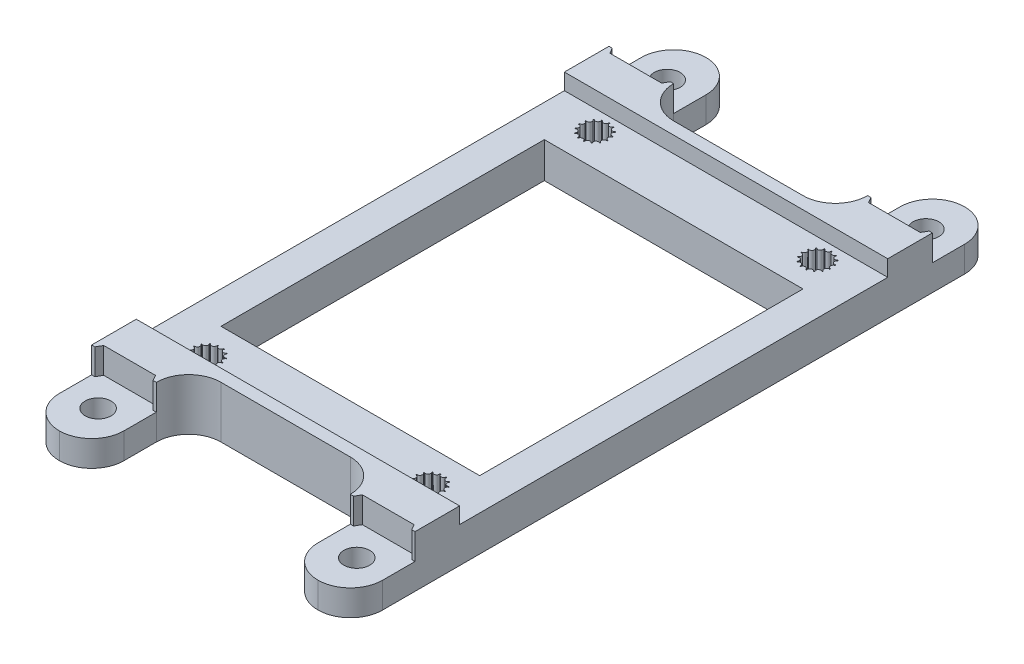
from build123d import *

# Parameters (mm, degrees)
SKETCH1_W                                  = 50
SKETCH1_H                                  = 70
BOSS_EXTRUDE1_DEPTH                        = 8
CUT_EXTRUDE1_DEPTH                         = 8
MIRROR1_AT_THE_SECOND_PLANE_COPY_1_DEPTH   = 8
SKETCH3_W                                  = 10
SKETCH3_H                                  = 15
SKETCH3_R                                  = 2
BOSS_EXTRUDE2_DEPTH                        = 8
MIRROR2_AT_THE_SECOND_PLANE_COPY_1_SKETC_W = 10
MIRROR2_AT_THE_SECOND_PLANE_COPY_1_SKETC_H = 15
MIRROR2_AT_THE_SECOND_PLANE_COPY_1_SKETC_R = 2
MIRROR2_AT_THE_SECOND_PLANE_COPY_1_DEPTH   = 8
FILLET1_R                                  = 5
CUT_EXTRUDE2_DEPTH                         = 4
MIRROR4_AT_THE_SECOND_PLANE_COPY_1_DEPTH   = 4
SKETCH5_W                                  = 40
SKETCH5_H                                  = 50
CUT_EXTRUDE3_DEPTH                         = 13
SKETCH6_W                                  = 50
SKETCH6_H                                  = 66.2
CUT_EXTRUDE4_DEPTH                         = 2.5


with BuildPart() as part:
    # Sketch1 → Boss-Extrude1 (new body)
    with BuildSketch(Plane(origin=(0, 0, 0), x_dir=(1, 0, 0), z_dir=(0, 1, 0))):
        with Locations((25, 35)):
            Rectangle(SKETCH1_W, SKETCH1_H)
    extrude(amount=BOSS_EXTRUDE1_DEPTH)

    # Sketch2 → Cut-Extrude1 (cut)
    with BuildSketch(Plane(origin=(0, 8, 0), x_dir=(1, 0, 0), z_dir=(0, 1, 0))):
        with BuildLine():
            ThreePointArc((9.960667609, 4.372293474), (9.639865506, 4.806622343), (10.043959363, 5.164761577))
            ThreePointArc((10.043959363, 5.164761577), (10.037674265, 5.235189042), (10.029179325, 5.305384245))
            ThreePointArc((10.029179325, 5.305384245), (9.559454555, 5.57168144), (9.782944313, 6.063217688))
            ThreePointArc((9.782944313, 6.063217688), (9.748557159, 6.125), (9.712245684, 6.185671305))
            ThreePointArc((9.712245684, 6.185671305), (9.174817927, 6.237891622), (9.179060176, 6.777833803))
            ThreePointArc((9.179060176, 6.777833803), (9.122516818, 6.820288237), (9.064667392, 6.860945025))
            ThreePointArc((9.064667392, 6.860945025), (8.55246279, 6.690059097), (8.336724007, 7.185046302))
            ThreePointArc((8.336724007, 7.185046302), (8.267801304, 7.200832102), (8.198416619, 7.214444444))
            ThreePointArc((8.198416619, 7.214444444), (7.8, 6.85), (7.401583381, 7.214444444))
            ThreePointArc((7.401583381, 7.214444444), (7.332198696, 7.200832102), (7.263275993, 7.185046302))
            ThreePointArc((7.263275993, 7.185046302), (7.279414078, 7.121153089), (7.284842553, 7.05547728))
            ThreePointArc((7.284842553, 7.05547728), (6.985331413, 6.668305497), (6.535332608, 6.860945025))
            ThreePointArc((6.535332608, 6.860945025), (6.477483182, 6.820288237), (6.420939824, 6.777833803))
            ThreePointArc((6.420939824, 6.777833803), (6.500218564, 6.651820533), (6.527924143, 6.505543864))
            ThreePointArc((6.527924143, 6.505543864), (6.30671462, 6.147725523), (5.887754316, 6.185671305))
            ThreePointArc((5.887754316, 6.185671305), (5.851442841, 6.125), (5.817055687, 6.063217688))
            ThreePointArc((5.817055687, 6.063217688), (5.993869104, 5.915772772), (6.060122838, 5.695288237))
            ThreePointArc((6.060122838, 5.695288237), (5.909400931, 5.382461716), (5.570820675, 5.305384245))
            ThreePointArc((5.570820675, 5.305384245), (5.562325735, 5.235189042), (5.556040637, 5.164761577))
            ThreePointArc((5.556040637, 5.164761577), (5.842937532, 5.049867127), (5.962325735, 4.764810958))
            ThreePointArc((5.962325735, 4.764810958), (5.871196794, 4.510648276), (5.639332391, 4.372293474))
            ThreePointArc((5.639332391, 4.372293474), (5.660122838, 4.304711763), (5.683026546, 4.237816691))
            ThreePointArc((5.683026546, 4.237816691), (6.066656087, 4.212169481), (6.251442841, 3.875))
            ThreePointArc((6.251442841, 3.875), (6.20640772, 3.690609287), (6.081443165, 3.547738864))
            ThreePointArc((6.081443165, 3.547738864), (6.127924143, 3.494456136), (6.176056398, 3.442660224))
            ThreePointArc((6.176056398, 3.442660224), (6.617892025, 3.554258631), (6.877483182, 3.179711763))
            ThreePointArc((6.877483182, 3.179711763), (6.863028211, 3.073151777), (6.820708029, 2.974293398))
            ThreePointArc((6.820708029, 2.974293398), (6.884842553, 2.94452272), (6.949880851, 2.916781953))
            ThreePointArc((6.949880851, 2.916781953), (7.391666595, 3.194722659), (7.732198696, 2.799167898))
            ThreePointArc((7.732198696, 2.799167898), (7.731473708, 2.775095823), (7.729301372, 2.751111007))
            ThreePointArc((7.729301372, 2.751111007), (7.8, 2.75), (7.870698628, 2.751111007))
            ThreePointArc((7.870698628, 2.751111007), (8.184636628, 3.190426939), (8.650119149, 2.916781953))
            ThreePointArc((8.650119149, 2.916781953), (8.715157447, 2.94452272), (8.779291971, 2.974293398))
            ThreePointArc((8.779291971, 2.974293398), (8.887402717, 3.50331856), (9.423943602, 3.442660224))
            ThreePointArc((9.423943602, 3.442660224), (9.472075857, 3.494456136), (9.518556835, 3.547738864))
            ThreePointArc((9.518556835, 3.547738864), (9.402146997, 4.075), (9.916973454, 4.237816691))
            ThreePointArc((9.916973454, 4.237816691), (9.939877162, 4.304711763), (9.960667609, 4.372293474))
        make_face()
    cut_extrude1 = extrude(amount=-CUT_EXTRUDE1_DEPTH, mode=Mode.SUBTRACT)

    # Mirror1: Cut-Extrude1 across plane
    add(cut_extrude1.mirror(Plane(origin=(0, 0, -35), x_dir=(1, 0, 0), z_dir=(0, 0, -1))), mode=Mode.SUBTRACT)

    # Mirror1 at the second plane: Cut-Extrude1 across plane
    add(cut_extrude1.mirror(Plane.ZY.offset(-25)), mode=Mode.SUBTRACT)

    # Mirror1 at the second plane copy 1 sketc → Mirror1 at the second plane copy 1 (cut)
    with BuildSketch(Plane(origin=(50, 8, -70), x_dir=(-1, 0, 0), z_dir=(0, 1, 0))):
        with BuildLine():
            ThreePointArc((9.960667609, 4.372293474), (9.639865506, 4.806622343), (10.043959363, 5.164761577))
            ThreePointArc((10.043959363, 5.164761577), (10.037674265, 5.235189042), (10.029179325, 5.305384245))
            ThreePointArc((10.029179325, 5.305384245), (9.559454555, 5.57168144), (9.782944313, 6.063217688))
            ThreePointArc((9.782944313, 6.063217688), (9.748557159, 6.125), (9.712245684, 6.185671305))
            ThreePointArc((9.712245684, 6.185671305), (9.174817927, 6.237891622), (9.179060176, 6.777833803))
            ThreePointArc((9.179060176, 6.777833803), (9.122516818, 6.820288237), (9.064667392, 6.860945025))
            ThreePointArc((9.064667392, 6.860945025), (8.55246279, 6.690059097), (8.336724007, 7.185046302))
            ThreePointArc((8.336724007, 7.185046302), (8.267801304, 7.200832102), (8.198416619, 7.214444444))
            ThreePointArc((8.198416619, 7.214444444), (7.8, 6.85), (7.401583381, 7.214444444))
            ThreePointArc((7.401583381, 7.214444444), (7.332198696, 7.200832102), (7.263275993, 7.185046302))
            ThreePointArc((7.263275993, 7.185046302), (7.279414078, 7.121153089), (7.284842553, 7.05547728))
            ThreePointArc((7.284842553, 7.05547728), (6.985331413, 6.668305497), (6.535332608, 6.860945025))
            ThreePointArc((6.535332608, 6.860945025), (6.477483182, 6.820288237), (6.420939824, 6.777833803))
            ThreePointArc((6.420939824, 6.777833803), (6.500218564, 6.651820533), (6.527924143, 6.505543864))
            ThreePointArc((6.527924143, 6.505543864), (6.30671462, 6.147725523), (5.887754316, 6.185671305))
            ThreePointArc((5.887754316, 6.185671305), (5.851442841, 6.125), (5.817055687, 6.063217688))
            ThreePointArc((5.817055687, 6.063217688), (5.993869104, 5.915772772), (6.060122838, 5.695288237))
            ThreePointArc((6.060122838, 5.695288237), (5.909400931, 5.382461716), (5.570820675, 5.305384245))
            ThreePointArc((5.570820675, 5.305384245), (5.562325735, 5.235189042), (5.556040637, 5.164761577))
            ThreePointArc((5.556040637, 5.164761577), (5.842937532, 5.049867127), (5.962325735, 4.764810958))
            ThreePointArc((5.962325735, 4.764810958), (5.871196794, 4.510648276), (5.639332391, 4.372293474))
            ThreePointArc((5.639332391, 4.372293474), (5.660122838, 4.304711763), (5.683026546, 4.237816691))
            ThreePointArc((5.683026546, 4.237816691), (6.066656087, 4.212169481), (6.251442841, 3.875))
            ThreePointArc((6.251442841, 3.875), (6.20640772, 3.690609287), (6.081443165, 3.547738864))
            ThreePointArc((6.081443165, 3.547738864), (6.127924143, 3.494456136), (6.176056398, 3.442660224))
            ThreePointArc((6.176056398, 3.442660224), (6.617892025, 3.554258631), (6.877483182, 3.179711763))
            ThreePointArc((6.877483182, 3.179711763), (6.863028211, 3.073151777), (6.820708029, 2.974293398))
            ThreePointArc((6.820708029, 2.974293398), (6.884842553, 2.94452272), (6.949880851, 2.916781953))
            ThreePointArc((6.949880851, 2.916781953), (7.391666595, 3.194722659), (7.732198696, 2.799167898))
            ThreePointArc((7.732198696, 2.799167898), (7.731473708, 2.775095823), (7.729301372, 2.751111007))
            ThreePointArc((7.729301372, 2.751111007), (7.8, 2.75), (7.870698628, 2.751111007))
            ThreePointArc((7.870698628, 2.751111007), (8.184636628, 3.190426939), (8.650119149, 2.916781953))
            ThreePointArc((8.650119149, 2.916781953), (8.715157447, 2.94452272), (8.779291971, 2.974293398))
            ThreePointArc((8.779291971, 2.974293398), (8.887402717, 3.50331856), (9.423943602, 3.442660224))
            ThreePointArc((9.423943602, 3.442660224), (9.472075857, 3.494456136), (9.518556835, 3.547738864))
            ThreePointArc((9.518556835, 3.547738864), (9.402146997, 4.075), (9.916973454, 4.237816691))
            ThreePointArc((9.916973454, 4.237816691), (9.939877162, 4.304711763), (9.960667609, 4.372293474))
        make_face()
    extrude(amount=-MIRROR1_AT_THE_SECOND_PLANE_COPY_1_DEPTH, mode=Mode.SUBTRACT)

    # Sketch3 → Boss-Extrude2 (add)
    with BuildSketch(Plane(origin=(0, 8, 0), x_dir=(1, 0, 0), z_dir=(0, 1, 0))):
        with Locations((5, -7.5)):
            Rectangle(SKETCH3_W, SKETCH3_H)
        with Locations(Location((5, -9, 0), (0, 0, 270))):
            Circle(SKETCH3_R, mode=Mode.SUBTRACT)
    boss_extrude2 = extrude(amount=-BOSS_EXTRUDE2_DEPTH)

    # Mirror2: Boss-Extrude2 across plane
    add(boss_extrude2.mirror(Plane(origin=(0, 0, -35), x_dir=(1, 0, 0), z_dir=(0, 0, -1))))

    # Mirror2 at the second plane: Boss-Extrude2 across plane
    add(boss_extrude2.mirror(Plane.ZY.offset(-25)))

    # Mirror2 at the second plane copy 1 sketc → Mirror2 at the second plane copy 1 (add)
    with BuildSketch(Plane(origin=(50, 8, -70), x_dir=(-1, 0, 0), z_dir=(0, 1, 0))):
        with Locations((5, -7.5)):
            Rectangle(MIRROR2_AT_THE_SECOND_PLANE_COPY_1_SKETC_W, MIRROR2_AT_THE_SECOND_PLANE_COPY_1_SKETC_H)
        with Locations(Location((5, -9, 0), (0, 0, 270))):
            Circle(MIRROR2_AT_THE_SECOND_PLANE_COPY_1_SKETC_R, mode=Mode.SUBTRACT)
    extrude(amount=-MIRROR2_AT_THE_SECOND_PLANE_COPY_1_DEPTH)

    # Fillet1
    fillet1_edges = [part.edges().sort_by_distance(p)[0] for p in [
        (0, 4, 15),
        (10, 4, 0),
        (10, 4, 15),
        (50, 4, 15),
        (40, 4, 15),
        (40, 4, 0),
        (0, 4, -85),
        (10, 4, -85),
        (10, 4, -70),
        (50, 4, -85),
        (40, 4, -70),
        (40, 4, -85),
    ]]
    fillet(fillet1_edges, radius=FILLET1_R - 0.0001)  # a hair under: the kernel refuses the full size

    # Sketch4 → Cut-Extrude2 (cut)
    with BuildSketch(Plane(origin=(0, 8, 0), x_dir=(1, 0, 0), z_dir=(0, 1, 0))):
        Polygon((1, -4.133974596), (0.5, -5), (0, -5), (0, -18.620495432), (15, -18.620495432), (15, -5), (9.5, -5), (9, -4.133974596), align=None)
    cut_extrude2 = extrude(amount=-CUT_EXTRUDE2_DEPTH, mode=Mode.SUBTRACT)

    # Mirror4: Cut-Extrude2 across plane
    add(cut_extrude2.mirror(Plane(origin=(0, 0, -35), x_dir=(1, 0, 0), z_dir=(0, 0, -1))), mode=Mode.SUBTRACT)

    # Mirror4 at the second plane: Cut-Extrude2 across plane
    add(cut_extrude2.mirror(Plane.ZY.offset(-25)), mode=Mode.SUBTRACT)

    # Mirror4 at the second plane copy 1 sketc → Mirror4 at the second plane copy 1 (cut)
    with BuildSketch(Plane(origin=(50, 8, -70), x_dir=(-1, 0, 0), z_dir=(0, 1, 0))):
        Polygon((1, -4.133974596), (0.5, -5), (0, -5), (0, -18.620495432), (15, -18.620495432), (15, -5), (9.5, -5), (9, -4.133974596), align=None)
    extrude(amount=-MIRROR4_AT_THE_SECOND_PLANE_COPY_1_DEPTH, mode=Mode.SUBTRACT)

    # Sketch5 → Cut-Extrude3 (cut)
    with BuildSketch(Plane(origin=(0, 8, 0), x_dir=(1, 0, 0), z_dir=(0, 1, 0))):
        with Locations((25, 35)):
            Rectangle(SKETCH5_W, SKETCH5_H)
    extrude(amount=-CUT_EXTRUDE3_DEPTH, mode=Mode.SUBTRACT)

    # Sketch6 → Cut-Extrude4 (cut)
    with BuildSketch(Plane(origin=(0, 8, 0), x_dir=(1, 0, 0), z_dir=(0, 1, 0))):
        with Locations((25, 35)):
            Rectangle(SKETCH6_W, SKETCH6_H)
    extrude(amount=-CUT_EXTRUDE4_DEPTH, mode=Mode.SUBTRACT)


solid = part.part
